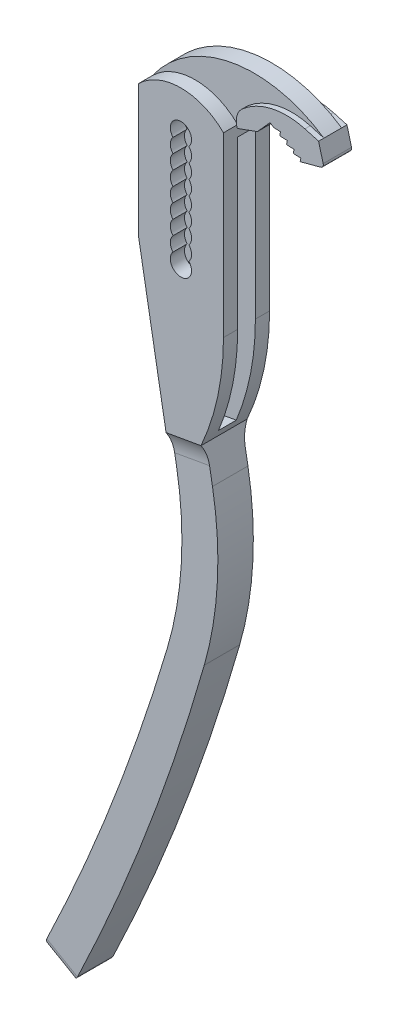
from build123d import *

# Parameters (mm, degrees)
BOSS_EXTRUDE1_DEPTH = 6.5
BOSS_EXTRUDE2_DEPTH = 5
BOSS_EXTRUDE3_DEPTH = 2.5
CUT_EXTRUDE1_DEPTH  = 211.126980415
LPATTERN1_COUNT     = 4
LPATTERN1_PITCH     = 2.25
BOSS_EXTRUDE4_DEPTH = 4
FILLET1_R           = 10
FILLET2_R           = 2
CUT_EXTRUDE4_DEPTH  = 2.5


with BuildPart() as part:
    # Sketch1 → Boss-Extrude1 (new, symmetric)
    with BuildSketch(Plane.XY):
        with BuildLine():
            Line((12, 24), (12, -26))
            ThreePointArc((12, -26), (10.397782984, -41.125604698), (5.662245525, -55.579867109))
            Line((5.662245525, -55.579867109), (-4.185832005, -57.316348886))
            Line((-4.185832005, -57.316348886), (-12, -13))
            Line((-12, -13), (-12, 24))
            ThreePointArc((-12, 24), (0, 28.958405421), (12, 24))
        make_face()
        with BuildLine():
            ThreePointArc((2.236067977, 15.76), (0, 20.76), (-2.236067977, 15.76))
            ThreePointArc((-2.236067977, 15.76), (-3, 13.76), (-2.236067977, 11.76))
            ThreePointArc((-2.236067977, 11.76), (-3, 9.76), (-2.236067977, 7.76))
            ThreePointArc((-2.236067977, 7.76), (-3, 5.76), (-2.236067977, 3.76))
            ThreePointArc((-2.236067977, 3.76), (-3, 1.76), (-2.236067977, -0.24))
            ThreePointArc((-2.236067977, -0.24), (-3, -2.24), (-2.236067977, -4.24))
            ThreePointArc((-2.236067977, -4.24), (-3, -6.24), (-2.236067977, -8.24))
            ThreePointArc((-2.236067977, -8.24), (-3, -10.24), (-2.236067977, -12.24))
            ThreePointArc((-2.236067977, -12.24), (0, -17.24), (2.236067978, -12.24))
            ThreePointArc((2.236067978, -12.24), (3, -10.24), (2.236067978, -8.24))
            ThreePointArc((2.236067978, -8.24), (3, -6.24), (2.236067978, -4.24))
            ThreePointArc((2.236067978, -4.24), (3, -2.24), (2.236067977, -0.24))
            ThreePointArc((2.236067977, -0.24), (3, 1.76), (2.236067977, 3.76))
            ThreePointArc((2.236067977, 3.76), (3, 5.76), (2.236067977, 7.76))
            ThreePointArc((2.236067977, 7.76), (3, 9.76), (2.236067977, 11.76))
            ThreePointArc((2.236067977, 11.76), (3, 13.76), (2.236067977, 15.76))
        make_face(mode=Mode.SUBTRACT)
    extrude(amount=BOSS_EXTRUDE1_DEPTH, both=True)

    # Sketch2 → Boss-Extrude2 (add, symmetric)
    with BuildSketch(Plane.XY):
        with BuildLine():
            Line((-4.185832005, -57.316348886), (-2.741272698, -65.50885182))
            ThreePointArc((-2.741272698, -65.50885182), (-1.385209123, -88.583801204), (-5.363349951, -111.353662711))
            ThreePointArc((-5.363349951, -111.353662711), (-20.948984173, -156.913011465), (-40.197837741, -201.049706962))
            Line((-40.197837741, -201.049706962), (-31.537583703, -206.049706962))
            ThreePointArc((-31.537583703, -206.049706962), (-11.143355809, -158.940001486), (5.078639021, -110.235835698))
            ThreePointArc((5.078639021, -110.235835698), (8.784169957, -87.963691821), (7.398727302, -65.427944639))
            Line((7.398727302, -65.427944639), (5.662245525, -55.579867109))
            Line((5.662245525, -55.579867109), (-4.185832005, -57.316348886))
        make_face()
    extrude(amount=BOSS_EXTRUDE2_DEPTH, both=True)

    # Sketch3 → Boss-Extrude3 (add, symmetric)
    with BuildSketch(Plane.XY):
        with BuildLine():
            Line((12, 24), (19.047694656, 26.565151075))
            Line((19.047694656, 26.565151075), (22.627047638, 30.541422221))
            Line((22.627047638, 30.541422221), (31.108189275, 25.243287027))
            Line((31.108189275, 25.243287027), (36.903744232, 26.796201298))
            ThreePointArc((36.903744232, 26.796201298), (37.510950591, 27.262127124), (37.610851014, 28.020946169))
            Line((37.610851014, 28.020946169), (36.316755788, 32.850575301))
            ThreePointArc((36.316755788, 32.850575301), (10.344991875, 38.324862138), (-12, 24))
            ThreePointArc((-12, 24), (0, 28.958405421), (12, 24))
        make_face()
    extrude(amount=BOSS_EXTRUDE3_DEPTH, both=True)

    # Sketch4 → Cut-Extrude1 (cut, through all)
    with BuildSketch(Plane.XY.offset(2.5)):
        Polygon((31.108189275, 25.243287027), (31.315979001, 26.221460544), (29.437730467, 26.28681595), align=None)
    cut_extrude1 = extrude(amount=-CUT_EXTRUDE1_DEPTH, mode=Mode.SUBTRACT)

    # LPattern1: Cut-Extrude1 ×4
    with Locations(*[Vector(-0.8481141636867628, 0.5298135194140507, 0) * (i * LPATTERN1_PITCH) for i in range(1, LPATTERN1_COUNT)]):
        add(cut_extrude1, mode=Mode.SUBTRACT)

    # Sketch5 → Boss-Extrude4 (add, symmetric)
    with BuildSketch(Plane.XY):
        with BuildLine():
            Line((13.409538931, 24.513030215), (19.047694656, 26.565151075))
            Line((19.047694656, 26.565151075), (22.627047638, 30.541422221))
            Line((22.627047638, 30.541422221), (23.712959862, 29.863057207))
            Line((23.712959862, 29.863057207), (25.591208397, 29.7977018))
            Line((25.591208397, 29.7977018), (25.38341867, 28.819528283))
            Line((25.38341867, 28.819528283), (25.62121673, 28.670976788))
            Line((25.62121673, 28.670976788), (27.499465265, 28.605621382))
            Line((27.499465265, 28.605621382), (27.291675538, 27.627447865))
            Line((27.291675538, 27.627447865), (27.529473599, 27.478896369))
            Line((27.529473599, 27.478896369), (29.407722133, 27.413540963))
            Line((29.407722133, 27.413540963), (29.199932406, 26.435367446))
            Line((29.199932406, 26.435367446), (29.437730467, 26.28681595))
            Line((29.437730467, 26.28681595), (31.315979001, 26.221460544))
            Line((31.315979001, 26.221460544), (31.108189275, 25.243287027))
            Line((31.108189275, 25.243287027), (36.903744232, 26.796201298))
            ThreePointArc((36.903744232, 26.796201298), (37.510950591, 27.262127124), (37.610851014, 28.020946169))
            Line((37.610851014, 28.020946169), (36.316755788, 32.850575301))
            Line((36.316755788, 32.850575301), (32.467935935, 33.939880464))
            ThreePointArc((32.467935935, 33.939880464), (23.148661732, 34.20032571), (14.827382616, 29.996396921))
            ThreePointArc((14.827382616, 29.996396921), (13.267210046, 27.474822952), (13.409538931, 24.513030215))
        make_face()
    extrude(amount=BOSS_EXTRUDE4_DEPTH, both=True)

    # Fillet1
    # the kernel refuses this fillet: 10 mm, written as the material it adds along each edge
    with BuildSketch(Plane(origin=(5.662245525, -55.579867109, 5), x_dir=(0.17364817766693216, -0.9848077530122078, 0), z_dir=(-0.9848077530122078, -0.1736481776669322, 0))) as fillet1_piece_1_section:
        with BuildLine():
            CenterArc((5.267826876, 10), FILLET1_R, 238.211669383, 31.788330617)
            Line((0, 1.5), (-0.105356538, 1.33))
            ThreePointArc((-0.105356538, 1.33), (-0.2, 0.75), (-0.2, 0))
            Line((-0.2, 0), (0, -0.2))
            Line((0, -0.2), (5.267826876, -0.2))
            Line((5.267826876, -0.2), (5.267826876, 0))
        make_face()
    fillet1_piece_1 = extrude(amount=10, mode=Mode.PRIVATE)
    fillet1_piece_1 = fillet1_piece_1 - Plane(origin=(-60.197153865, -26, 5.108748651), x_dir=(1, 0, 0), z_dir=(0, 0, 1)) * Cylinder(72.197153865, 42, mode=Mode.PRIVATE)
    add(fillet1_piece_1)
    with BuildSketch(Plane(origin=(18.631737399, -53.292995765, 5), x_dir=(0.1736481776669322, -0.9848077530122078, 0), z_dir=(-0.9848077530122078, -0.1736481776669322, 0))) as fillet1_piece_2_section:
        with BuildLine():
            CenterArc((5.267826876, 10), FILLET1_R, 238.211669383, 31.788330617)
            Line((0, 1.5), (-0.105356538, 1.33))
            ThreePointArc((-0.105356538, 1.33), (-0.2, 0.75), (-0.2, 0))
            Line((-0.2, 0), (0, -0.2))
            Line((0, -0.2), (5.267826876, -0.2))
            Line((5.267826876, -0.2), (5.267826876, 0))
        make_face()
    fillet1_piece_2 = extrude(amount=23.169567191, mode=Mode.PRIVATE)
    fillet1_piece_2 = split(fillet1_piece_2, bisect_by=Plane(origin=(5.639763501, -55.452365217, 5.544024215), z_dir=(0.9848077530122079, 0.17364817766693152, 0)), keep=Keep.TOP, mode=Mode.PRIVATE)
    fillet1_piece_2 = fillet1_piece_2 & Plane(origin=(-60.197153865, -26, 5.544024215), x_dir=(1, 0, 0), z_dir=(0, 0, 1)) * Cylinder(72.197153865, 68, mode=Mode.PRIVATE)
    add(fillet1_piece_2)
    with BuildSketch(Plane(origin=(5.662245525, -55.579867109, 5), x_dir=(0.17364817766693216, -0.9848077530122078, 0), z_dir=(-0.9848077530122078, -0.1736481776669322, 0))) as fillet1_piece_3_section:
        with BuildLine():
            CenterArc((5.267826876, 10), FILLET1_R, 238.211669383, 31.788330617)
            Line((0, 1.5), (-0.105356538, 1.33))
            ThreePointArc((-0.105356538, 1.33), (-0.2, 0.75), (-0.2, 0))
            Line((-0.2, 0), (0, -0.2))
            Line((0, -0.2), (5.267826876, -0.2))
            Line((5.267826876, -0.2), (5.267826876, 0))
        make_face()
    fillet1_piece_3 = extrude(amount=10, mode=Mode.PRIVATE)
    fillet1_piece_3 = fillet1_piece_3 & Plane(origin=(-60.197153865, -26, 5.331257978), x_dir=(1, 0, 0), z_dir=(0, 0, 1)) * Cylinder(72.197153865, 42, mode=Mode.PRIVATE)
    add(fillet1_piece_3)
    with BuildSketch(Plane(origin=(5.662245525, -55.579867109, -5), x_dir=(0, 0, -1), z_dir=(-0.9848077530122078, -0.1736481776669322, 0))) as fillet1_piece_4_section:
        with BuildLine():
            CenterArc((10, 5.267826876), FILLET1_R, 180, 31.788330617)
            Line((0, 5.267826876), (-0.2, 5.267826876))
            Line((-0.2, 5.267826876), (-0.2, 0))
            Line((-0.2, 0), (0, -0.2))
            ThreePointArc((0, -0.2), (0.75, -0.2), (1.33, -0.105356538))
            Line((1.33, -0.105356538), (1.5, 0))
        make_face()
    fillet1_piece_4 = extrude(amount=10, mode=Mode.PRIVATE)
    fillet1_piece_4 = fillet1_piece_4 - Plane(origin=(-60.197153865, -26, -5.108748651), x_dir=(1, 0, 0), z_dir=(0, 0, 1)) * Cylinder(72.197153865, 42, mode=Mode.PRIVATE)
    add(fillet1_piece_4)
    with BuildSketch(Plane(origin=(5.662245525, -55.579867109, -5), x_dir=(0, 0, -1), z_dir=(-0.9848077530122078, -0.1736481776669322, 0))) as fillet1_piece_5_section:
        with BuildLine():
            CenterArc((10, 5.267826876), FILLET1_R, 180, 31.788330617)
            Line((0, 5.267826876), (-0.2, 5.267826876))
            Line((-0.2, 5.267826876), (-0.2, 0))
            Line((-0.2, 0), (0, -0.2))
            ThreePointArc((0, -0.2), (0.75, -0.2), (1.33, -0.105356538))
            Line((1.33, -0.105356538), (1.5, 0))
        make_face()
    fillet1_piece_5 = extrude(amount=10, mode=Mode.PRIVATE)
    fillet1_piece_5 = fillet1_piece_5 & Plane(origin=(-60.197153865, -26, -5.331257978), x_dir=(1, 0, 0), z_dir=(0, 0, 1)) * Cylinder(72.197153865, 42, mode=Mode.PRIVATE)
    add(fillet1_piece_5)
    with BuildSketch(Plane(origin=(18.631737399, -53.292995765, -5), x_dir=(0, 0, -1), z_dir=(-0.9848077530122078, -0.1736481776669322, 0))) as fillet1_piece_6_section:
        with BuildLine():
            CenterArc((10, 5.267826876), FILLET1_R, 180, 31.788330617)
            Line((0, 5.267826876), (-0.2, 5.267826876))
            Line((-0.2, 5.267826876), (-0.2, 0))
            Line((-0.2, 0), (0, -0.2))
            ThreePointArc((0, -0.2), (0.75, -0.2), (1.33, -0.105356538))
            Line((1.33, -0.105356538), (1.5, 0))
        make_face()
    fillet1_piece_6 = extrude(amount=23.169567191, mode=Mode.PRIVATE)
    fillet1_piece_6 = fillet1_piece_6 & Plane(origin=(-60.197153865, -26, -5.544024216), x_dir=(1, 0, 0), z_dir=(0, 0, 1)) * Cylinder(72.197153865, 68, mode=Mode.PRIVATE)
    fillet1_piece_6 = split(fillet1_piece_6, bisect_by=Plane(origin=(5.639763501, -55.452365217, -5.544024216), z_dir=(0.9848077530122079, 0.17364817766693152, 0)), keep=Keep.TOP, mode=Mode.PRIVATE)
    add(fillet1_piece_6)

    # Fillet2
    # the kernel refuses this fillet: 2 mm, written as the material it takes off along each edge
    with BuildSketch(Plane(origin=(-44.52796476, -198.549706962, -5), x_dir=(0.5000000000000003, 0.8660254037844385, 0), z_dir=(0.8660254037844386, -0.5000000000000003, 0)), Plane(origin=(-44.52796476, -198.549706962, 5), x_dir=(0, 0, -1), z_dir=(0.8660254037844386, -0.5000000000000003, 0))) as fillet2_piece_1:
        with BuildLine():
            CenterArc((FILLET2_R, FILLET2_R), FILLET2_R, 180, 90)
            Line((0, FILLET2_R), (0, 0))
            Line((0, 0), (FILLET2_R, 0))
        make_face()
    extrude(amount=20, mode=Mode.SUBTRACT)
    with BuildSketch(Plane(origin=(-40.197837741, -201.049706962, -9.647216237), x_dir=(0.8660254037844397, -0.4999999999999982, 0), z_dir=(0, 0, 1))) as fillet2_piece_2:
        with BuildLine():
            CenterArc((1.858886495, 2), FILLET2_R, 184.278600347, 85.721399653)
            ThreePointArc((-0.135539641, 1.850787443), (-0.067042153, 0.925447011), (0, 0))
            Line((0, 0), (1.858886495, 0))
        make_face()
    extrude(amount=19.294432475, mode=Mode.SUBTRACT)
    with BuildSketch(Plane(origin=(-31.537583703, -206.049706962, 10.39006535), x_dir=(-0.8660254037844383, 0.5000000000000006, 0), z_dir=(0, 0, -1))) as fillet2_piece_3:
        with BuildLine():
            CenterArc((2.152368756, 2), FILLET2_R, 175.692238748, 94.307761252)
            ThreePointArc((0.158018821, 2.150227608), (0.078027217, 1.075185985), (0, 0))
            Line((0, 0), (2.152368756, 0))
        make_face()
    extrude(amount=20.780130699, mode=Mode.SUBTRACT)

    # Sketch10 → Cut-Extrude4 (cut, symmetric)
    with BuildSketch(Plane.XY):
        with BuildLine():
            Line((-4.53312836, -55.34673338), (6.605682372, -53.382660514))
            ThreePointArc((6.605682372, -53.382660514), (10.638584547, -39.954468456), (12, -26))
            Line((12, -26), (12, 20.958405421))
            ThreePointArc((12, 20.958405421), (0, 26.958405421), (-12, 20.958405421))
            Line((-12, 20.958405421), (-12, -13))
            Line((-12, -13), (-4.53312836, -55.34673338))
        make_face()
    extrude(amount=CUT_EXTRUDE4_DEPTH, both=True, mode=Mode.SUBTRACT)


solid = part.part
